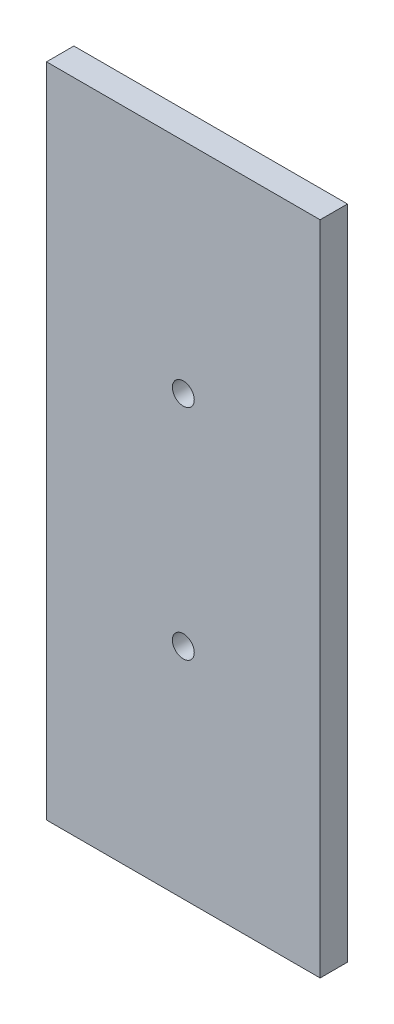
from build123d import *

# Parameters (mm, degrees)
ESQUISSE1_W        = 50
ESQUISSE1_H        = 120
ESQUISSE1_R        = 2
BOSS_EXTRU_1_DEPTH = 5


with BuildPart() as part:
    # Esquisse1 → Boss.-Extru.1 (new body)
    with BuildSketch(Plane.XY):
        Rectangle(ESQUISSE1_W, ESQUISSE1_H)
        with Locations((0, 20)):
            Circle(ESQUISSE1_R, mode=Mode.SUBTRACT)
        with Locations((0, -20)):
            Circle(ESQUISSE1_R, mode=Mode.SUBTRACT)
    extrude(amount=BOSS_EXTRU_1_DEPTH)


solid = part.part
